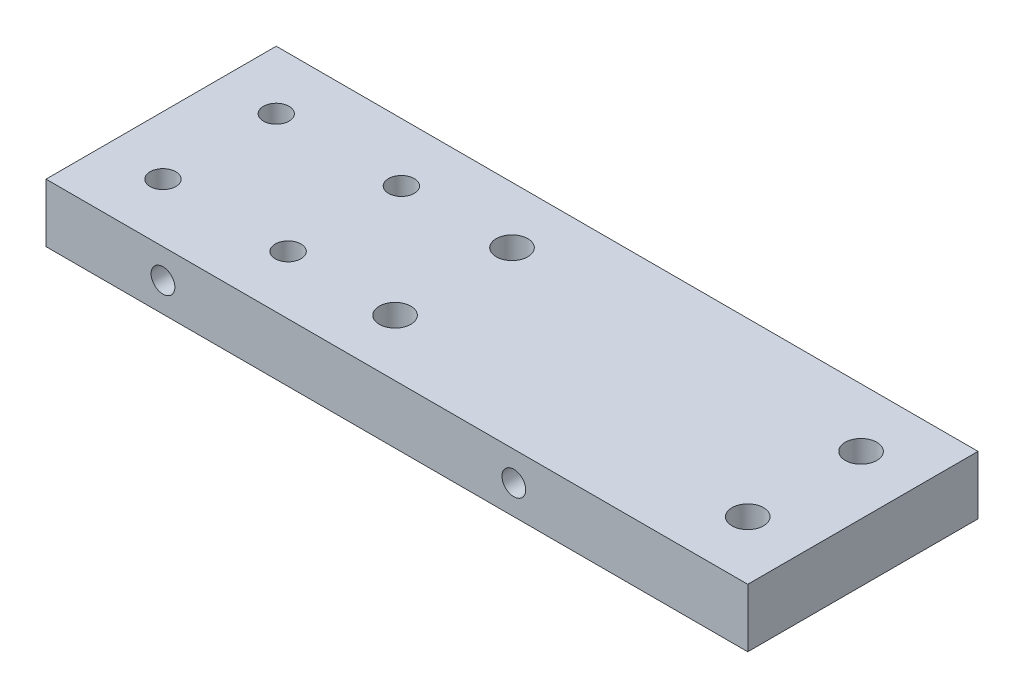
from build123d import *

# Parameters (mm, degrees)
SKETCH1_W           = 152.4
SKETCH1_H           = 50
BOSS_EXTRUDE1_DEPTH = 12.7
CUT_EXTRUDE2_REACH  = 83.196
SKETCH3_R           = 2.794
SKETCH3_R_2         = 3.429
SKETCH4_R           = 4.445
CUT_EXTRUDE3_DEPTH  = 6.096
SKETCH5_R           = 2.5796875
CUT_EXTRUDE4_DEPTH  = 12.7
CUT_EXTRUDE5_START  = -12.7
SKETCH6_R           = 2.5796875
CUT_EXTRUDE5_DEPTH  = 12.7


with BuildPart() as part:
    # Sketch1 → Boss-Extrude1 (new body)
    with BuildSketch(Plane(origin=(0, 0, 0), x_dir=(1, 0, 0), z_dir=(0, 1, 0))):
        Rectangle(SKETCH1_W, SKETCH1_H)
    extrude(amount=BOSS_EXTRUDE1_DEPTH)

    # Sketch3 → Cut-Extrude2 (cut, up to next)
    with BuildSketch(Plane.XZ, mode=Mode.PRIVATE) as cut_extrude2_sk1:
        with Locations((-63.5, 12.3)):
            Circle(SKETCH3_R)
    cut_extrude2_tool1 = extrude(cut_extrude2_sk1.sketch, amount=-CUT_EXTRUDE2_REACH, mode=Mode.PRIVATE) & part.part
    # Sketch3 → Cut-Extrude2 (cut, up to next)
    with BuildSketch(Plane.XZ, mode=Mode.PRIVATE) as cut_extrude2_sk2:
        with Locations((-63.5, -12.3)):
            Circle(SKETCH3_R)
    cut_extrude2_tool2 = extrude(cut_extrude2_sk2.sketch, amount=-CUT_EXTRUDE2_REACH, mode=Mode.PRIVATE) & part.part
    # Sketch3 → Cut-Extrude2 (cut, up to next)
    with BuildSketch(Plane.XZ, mode=Mode.PRIVATE) as cut_extrude2_sk3:
        with Locations((63.5, 12.3)):
            Circle(SKETCH3_R_2)
    cut_extrude2_tool3 = extrude(cut_extrude2_sk3.sketch, amount=-CUT_EXTRUDE2_REACH, mode=Mode.PRIVATE) & part.part
    # Sketch3 → Cut-Extrude2 (cut, up to next)
    with BuildSketch(Plane.XZ, mode=Mode.PRIVATE) as cut_extrude2_sk4:
        with Locations((63.5, -12.3)):
            Circle(SKETCH3_R_2)
    cut_extrude2_tool4 = extrude(cut_extrude2_sk4.sketch, amount=-CUT_EXTRUDE2_REACH, mode=Mode.PRIVATE) & part.part
    # Sketch3 → Cut-Extrude2 (cut, up to next)
    with BuildSketch(Plane.XZ, mode=Mode.PRIVATE) as cut_extrude2_sk5:
        with Locations((-12.698950153, 12.699994489)):
            Circle(SKETCH3_R_2)
    cut_extrude2_tool5 = extrude(cut_extrude2_sk5.sketch, amount=-CUT_EXTRUDE2_REACH, mode=Mode.PRIVATE) & part.part
    # Sketch3 → Cut-Extrude2 (cut, up to next)
    with BuildSketch(Plane.XZ, mode=Mode.PRIVATE) as cut_extrude2_sk6:
        with Locations((-12.698950153, -12.699994489)):
            Circle(SKETCH3_R_2)
    cut_extrude2_tool6 = extrude(cut_extrude2_sk6.sketch, amount=-CUT_EXTRUDE2_REACH, mode=Mode.PRIVATE) & part.part
    # Sketch3 → Cut-Extrude2 (cut, up to next)
    with BuildSketch(Plane.XZ, mode=Mode.PRIVATE) as cut_extrude2_sk7:
        with Locations((-36.322, 12.3)):
            Circle(SKETCH3_R)
    cut_extrude2_tool7 = extrude(cut_extrude2_sk7.sketch, amount=-CUT_EXTRUDE2_REACH, mode=Mode.PRIVATE) & part.part
    # Sketch3 → Cut-Extrude2 (cut, up to next)
    with BuildSketch(Plane.XZ, mode=Mode.PRIVATE) as cut_extrude2_sk8:
        with Locations((-36.322, -12.3)):
            Circle(SKETCH3_R)
    cut_extrude2_tool8 = extrude(cut_extrude2_sk8.sketch, amount=-CUT_EXTRUDE2_REACH, mode=Mode.PRIVATE) & part.part
    add(cut_extrude2_tool1.solids().sort_by_distance((-63.5, 0, 12.3))[0], mode=Mode.SUBTRACT)
    add(cut_extrude2_tool2.solids().sort_by_distance((-63.5, 0, -12.3))[0], mode=Mode.SUBTRACT)
    add(cut_extrude2_tool3.solids().sort_by_distance((63.5, 0, 12.3))[0], mode=Mode.SUBTRACT)
    add(cut_extrude2_tool4.solids().sort_by_distance((63.5, 0, -12.3))[0], mode=Mode.SUBTRACT)
    add(cut_extrude2_tool5.solids().sort_by_distance((-12.69895, 0, 12.699994))[0], mode=Mode.SUBTRACT)
    add(cut_extrude2_tool6.solids().sort_by_distance((-12.69895, 0, -12.699994))[0], mode=Mode.SUBTRACT)
    add(cut_extrude2_tool7.solids().sort_by_distance((-36.322, 0, 12.3))[0], mode=Mode.SUBTRACT)
    add(cut_extrude2_tool8.solids().sort_by_distance((-36.322, 0, -12.3))[0], mode=Mode.SUBTRACT)

    # Sketch4 → Cut-Extrude3 (cut)
    with BuildSketch(Plane.XZ):
        with Locations((-63.5, 12.3)):
            Circle(SKETCH4_R)
        with Locations((-36.322, 12.3)):
            Circle(SKETCH4_R)
        with Locations((-36.322, -12.3)):
            Circle(SKETCH4_R)
        with Locations((-63.5, -12.3)):
            Circle(SKETCH4_R)
    extrude(amount=-CUT_EXTRUDE3_DEPTH, mode=Mode.SUBTRACT)

    # Sketch5 → Cut-Extrude4 (cut)
    with BuildSketch(Plane(origin=(0, 0, -25), x_dir=(-1, 0, 0), z_dir=(0, 0, -1))):
        with Locations((50.8, 6.35)):
            Circle(SKETCH5_R)
        with Locations((-25.4, 6.35)):
            Circle(SKETCH5_R)
    extrude(amount=-CUT_EXTRUDE4_DEPTH, mode=Mode.SUBTRACT)

    # Sketch6 → Cut-Extrude5 (cut)
    with BuildSketch(Plane.XY.offset(25).offset(CUT_EXTRUDE5_START)):
        with Locations((25.4, 6.35)):
            Circle(SKETCH6_R)
        with Locations((-50.8, 6.35)):
            Circle(SKETCH6_R)
    extrude(amount=CUT_EXTRUDE5_DEPTH, mode=Mode.SUBTRACT)


solid = part.part
